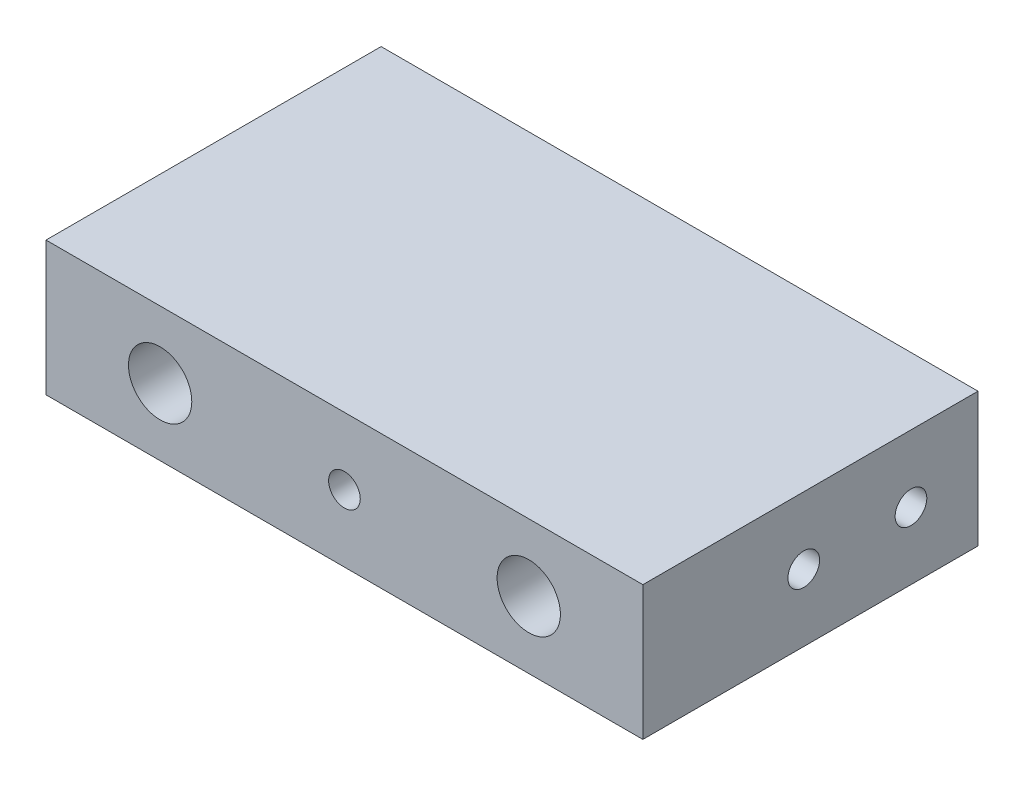
from build123d import *

# Parameters (mm, degrees)
SKETCH1_W           = 56.55
SKETCH1_H           = 12.7
BOSS_EXTRUDE1_DEPTH = 31.75
SKETCH2_R           = 3
SKETCH2_R_2         = 1.5
CUT_EXTRUDE1_DEPTH  = 10
SKETCH3_R           = 1.5
CUT_EXTRUDE2_DEPTH  = 66.163544256


with BuildPart() as part:
    # Sketch1 → Boss-Extrude1 (new body)
    with BuildSketch(Plane.XY):
        Rectangle(SKETCH1_W, SKETCH1_H)
    extrude(amount=BOSS_EXTRUDE1_DEPTH)

    # Sketch2 → Cut-Extrude1 (cut)
    with BuildSketch(Plane.XY.offset(31.75)):
        with Locations((17.4625, 0)):
            Circle(SKETCH2_R)
        with Locations((-17.4625, 0)):
            Circle(SKETCH2_R)
        Circle(SKETCH2_R_2)
    extrude(amount=-CUT_EXTRUDE1_DEPTH, mode=Mode.SUBTRACT)

    # Sketch3 → Cut-Extrude2 (cut, through all)
    with BuildSketch(Plane.ZY.offset(28.275)):
        with Locations((16.51, 0)):
            Circle(SKETCH3_R)
        with Locations((6.35, 0)):
            Circle(SKETCH3_R)
    extrude(amount=-CUT_EXTRUDE2_DEPTH, mode=Mode.SUBTRACT)


solid = part.part
